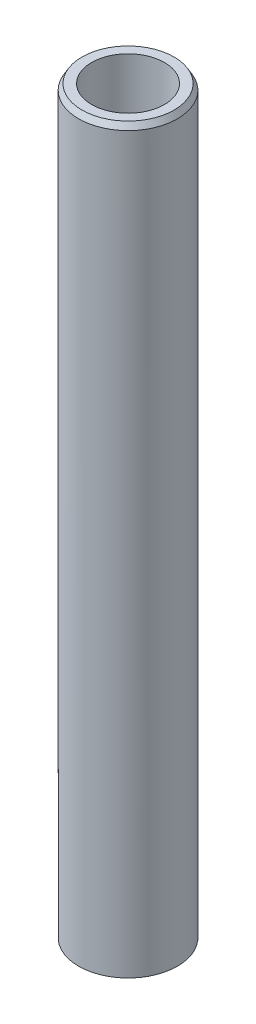
from build123d import *
from OCP.BRepFilletAPI import BRepFilletAPI_MakeChamfer

# Parameters (mm, degrees)
SKETCH1_R           = 25
BOSS_EXTRUDE1_DEPTH = 375.96097246
SKETCH2_R           = 18.432775166
CUT_EXTRUDE1_DEPTH  = 378.619719841
CHAMFER1_SIZE       = 2.973821064
CHAMFER1_SIZE2      = 1.716936392


with BuildPart() as part:
    # Sketch1 → Boss-Extrude1 (new body)
    with BuildSketch(Plane(origin=(0, 0, 0), x_dir=(1, 0, 0), z_dir=(0, 1, 0))):
        Circle(SKETCH1_R)
    extrude(amount=BOSS_EXTRUDE1_DEPTH)

    # Sketch2 → Cut-Extrude1 (cut, through all)
    with BuildSketch(Plane(origin=(0, 0, 0), x_dir=(1, 0, 0), z_dir=(0, 1, 0))):
        Circle(SKETCH2_R)
    extrude(amount=CUT_EXTRUDE1_DEPTH, mode=Mode.SUBTRACT)

    # Chamfer1: one chamfer whose edges measure the first distance from different faces: ONE call of the kernel's chamfer builder (chamfer() names one face for all edges)
    chamfer1_edges_1 = [part.edges().sort_by_distance(p)[0] for p in [
        (-25, 375.96097246, 0),
    ]]
    chamfer1_side_1 = [part.faces().sort_by_distance(p)[0] for p in [
        (-25, 187.98048623, 0),
    ]]
    chamfer1_edges_2 = [part.edges().sort_by_distance(p)[0] for p in [
        (-25, 0, 0),
    ]]
    chamfer1_side_2 = [part.faces().sort_by_distance(p)[0] for p in [
        (-24.292893219, 0, 0),
    ]]
    chamfer1 = BRepFilletAPI_MakeChamfer(part.part.solid().wrapped)
    for e in chamfer1_edges_1:
        chamfer1.Add(CHAMFER1_SIZE, CHAMFER1_SIZE2, e.wrapped, chamfer1_side_1[0].wrapped)  # the first distance lies on this face
    for e in chamfer1_edges_2:
        chamfer1.Add(CHAMFER1_SIZE, CHAMFER1_SIZE2, e.wrapped, chamfer1_side_2[0].wrapped)  # the first distance lies on this face
    add(Compound.cast(chamfer1.Shape()), mode=Mode.REPLACE)


solid = part.part
